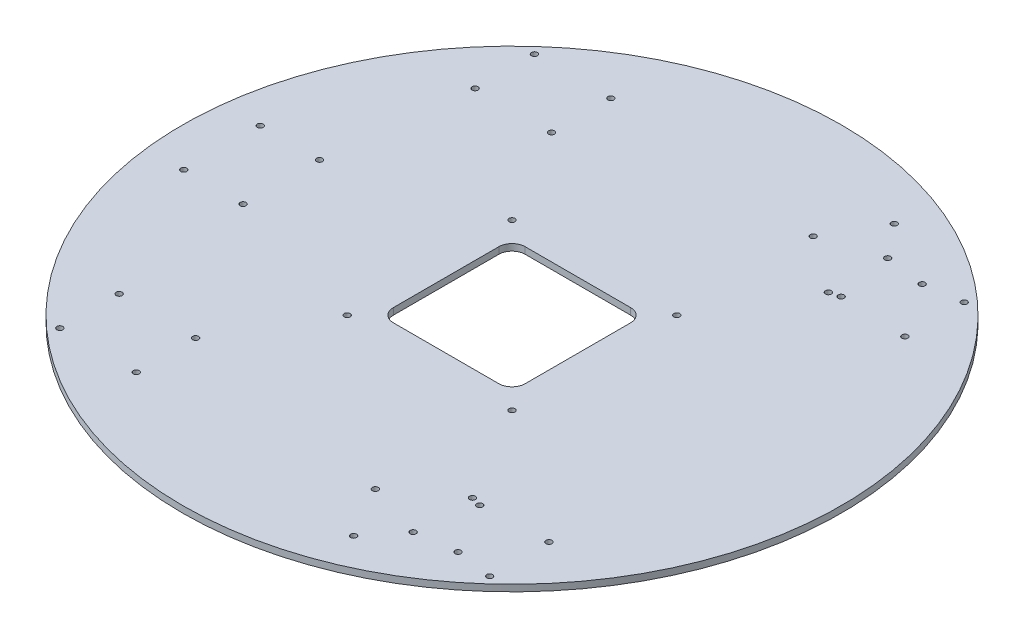
from build123d import *

# Parameters (mm, degrees)
SKETCH_1_R          = 250
EXTRUDE_1_DEPTH     = 5
SKETCH_2_R          = 2.25
CUT_EXTRUDE_1_DEPTH = 354.588744165
SKETCH_3_R          = 2.25
CUT_EXTRUDE_2_DEPTH = 354.588744165
CUT_EXTRUDE4_DEPTH  = 354.588744165


with BuildPart() as part:
    # 草图1 → 凸台-拉伸1 (new body)
    with BuildSketch(Plane(origin=(0, 0, 0), x_dir=(1, 0, 0), z_dir=(0, 1, 0))):
        Circle(SKETCH_1_R)
    extrude(amount=EXTRUDE_1_DEPTH)

    # 草图2 → 切除-拉伸1 (cut, through all)
    with BuildSketch(Plane(origin=(0, 5, 0), x_dir=(1, 0, 0), z_dir=(0, 1, 0))):
        with Locations((-220, -29)):
            Circle(SKETCH_2_R)
        with Locations((-220, 29)):
            Circle(SKETCH_2_R)
        with Locations((-175, -29)):
            Circle(SKETCH_2_R)
        with Locations((-175, 29)):
            Circle(SKETCH_2_R)
        with Locations((84.88526329, 205.025588833)):
            Circle(SKETCH_2_R)
        with Locations((135.11473671, 176.025588833)):
            Circle(SKETCH_2_R)
        with Locations((62.38526329, 166.054445662)):
            Circle(SKETCH_2_R)
        with Locations((112.61473671, 137.054445662)):
            Circle(SKETCH_2_R)
        with Locations((135.11473671, -176.025588833)):
            Circle(SKETCH_2_R)
        with Locations((84.88526329, -205.025588833)):
            Circle(SKETCH_2_R)
        with Locations((112.61473671, -137.054445662)):
            Circle(SKETCH_2_R)
        with Locations((62.38526329, -166.054445662)):
            Circle(SKETCH_2_R)
    extrude(amount=-CUT_EXTRUDE_1_DEPTH, mode=Mode.SUBTRACT)

    # 草图3 → 切除-拉伸2 (cut, through all)
    with BuildSketch(Plane(origin=(0, 5, 0), x_dir=(1, 0, 0), z_dir=(0, 1, 0))):
        with Locations((163, 135)):
            Circle(SKETCH_3_R)
        with Locations((105, 135)):
            Circle(SKETCH_3_R)
        with Locations((105, 180)):
            Circle(SKETCH_3_R)
        with Locations((163, 180)):
            Circle(SKETCH_3_R)
        with Locations((-163, 180)):
            Circle(SKETCH_3_R)
        with Locations((-105, 180)):
            Circle(SKETCH_3_R)
        with Locations((-105, 135)):
            Circle(SKETCH_3_R)
        with Locations((-163, 135)):
            Circle(SKETCH_3_R)
        with Locations((-163, -135)):
            Circle(SKETCH_3_R)
        with Locations((-105, -135)):
            Circle(SKETCH_3_R)
        with Locations((-105, -180)):
            Circle(SKETCH_3_R)
        with Locations((-163, -180)):
            Circle(SKETCH_3_R)
        with Locations((163, -180)):
            Circle(SKETCH_3_R)
        with Locations((105, -180)):
            Circle(SKETCH_3_R)
        with Locations((105, -135)):
            Circle(SKETCH_3_R)
        with Locations((163, -135)):
            Circle(SKETCH_3_R)
        with Locations((-62.5, 62.5)):
            Circle(SKETCH_3_R)
        with Locations((62.5, 62.5)):
            Circle(SKETCH_3_R)
        with Locations((62.5, -62.5)):
            Circle(SKETCH_3_R)
        with Locations((-62.5, -62.5)):
            Circle(SKETCH_3_R)
    extrude(amount=-CUT_EXTRUDE_2_DEPTH, mode=Mode.SUBTRACT)

    # Sketch2 → Cut-Extrude4 (cut, through all)
    with BuildSketch(Plane.XZ):
        with BuildLine():
            Line((-50, 40), (-50, -40))
            ThreePointArc((-50, -40), (-47.071067812, -47.071067812), (-40, -50))
            Line((-40, -50), (40, -50))
            ThreePointArc((40, -50), (47.071067812, -47.071067812), (50, -40))
            Line((50, -40), (50, 40))
            ThreePointArc((50, 40), (47.071067812, 47.071067812), (40, 50))
            Line((40, 50), (-40, 50))
            ThreePointArc((-40, 50), (-47.071067812, 47.071067812), (-50, 40))
        make_face()
    extrude(amount=-CUT_EXTRUDE4_DEPTH, mode=Mode.SUBTRACT)


solid = part.part
